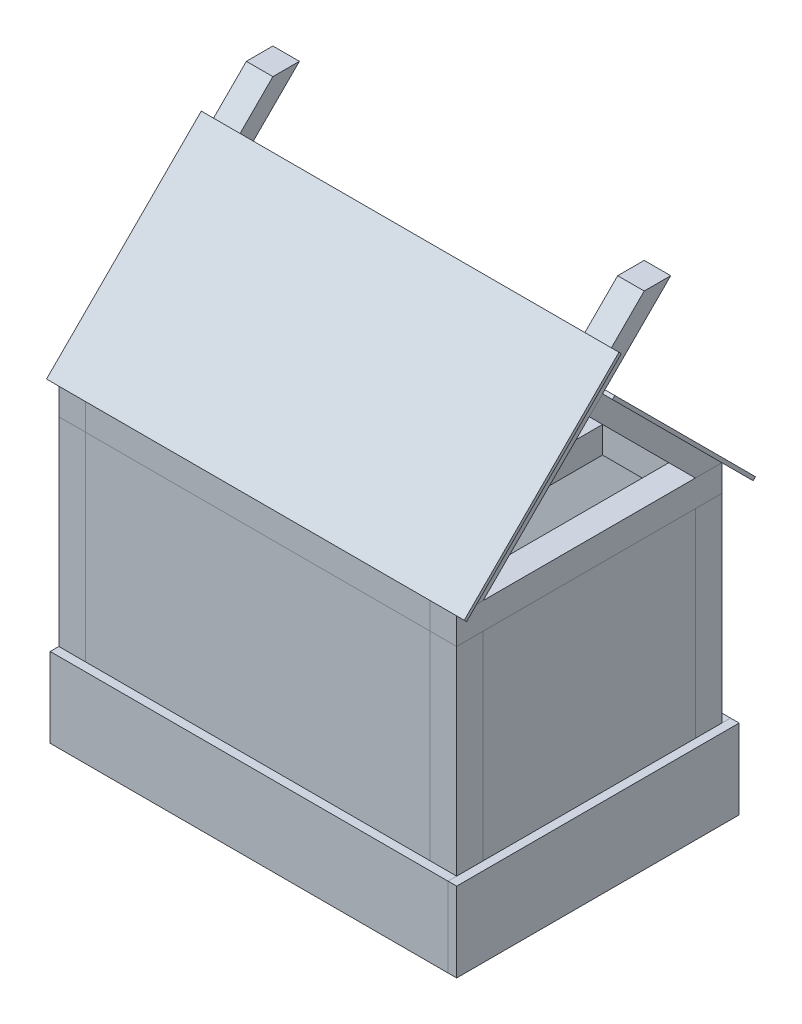
from build123d import *

# Parameters (mm, degrees)
SKETCH1_W              = 60
SKETCH1_H              = 40
BOSS_EXTRUDE1_DEPTH    = 2
SKETCH2_W              = 4
SKETCH2_H              = 4
BOSS_EXTRUDE2_DEPTH    = 40
SKETCH5_W              = 60
SKETCH5_H              = 12
BOSS_EXTRUDE4_DEPTH    = 1.3
SKETCH4_W              = 11
SKETCH4_H              = 7
BOSS_EXTRUDE5_DEPTH    = 1.3
BOSS_EXTRUDE5_2_DEPTH  = 1.3
SKETCH8_W              = 4
SKETCH8_H              = 40
BOSS_EXTRUDE8_DEPTH    = 4
BOSS_EXTRUDE8_2_DEPTH  = 4
SKETCH8_4_W            = 52
SKETCH8_4_H            = 4
BOSS_EXTRUDE9_DEPTH    = 4
BOSS_EXTRUDE9_2_DEPTH  = 4
SKETCH9_W              = 60
SKETCH9_H              = 12
BOSS_EXTRUDE10_DEPTH   = 1.3
SKETCH10_W             = 42.6
SKETCH10_H             = 12
BOSS_EXTRUDE11_DEPTH   = 1.3
SKETCH11_W             = 4
SKETCH11_H             = 32
BOSS_EXTRUDE12_DEPTH   = 4
BOSS_EXTRUDE12_2_DEPTH = 4
SKETCH13_W             = 4
SKETCH13_H             = 4
SWEEP3_START           = -30
SWEEP3_DEPTH           = 4
SKETCH17_W             = 4
SKETCH17_H             = 4
SWEEP5_START           = 26
SWEEP5_DEPTH           = 4
BOSS_EXTRUDE13_DEPTH   = 52
BOSS_EXTRUDE15_DEPTH   = 0.5
SKETCH23_W             = 63
SKETCH23_H             = 33
BOSS_EXTRUDE16_DEPTH   = 0.5
SKETCH24_W             = 52
SKETCH24_H             = 0.5
BOSS_EXTRUDE17_DEPTH   = 1.914214
BOSS_EXTRUDE19_DEPTH   = 0.5
SKETCH29_W             = 52
SKETCH29_H             = 40
BOSS_EXTRUDE21_DEPTH   = 0.5
SKETCH30_W             = 52
SKETCH30_H             = 40
BOSS_EXTRUDE22_DEPTH   = 0.5
SKETCH28_W             = 32
SKETCH28_H             = 40
BOSS_EXTRUDE25_DEPTH   = 0.5


# Read off the part's stored shape, not the designer's step: Sweep3, Sweep5
with BuildPart() as part:
    # Sketch1 → Boss-Extrude1 (new body)
    with BuildSketch(Plane(origin=(0, 0, 0), x_dir=(1, 0, 0), z_dir=(0, 1, 0))):
        Rectangle(SKETCH1_W, SKETCH1_H)
    extrude(amount=BOSS_EXTRUDE1_DEPTH)

    # Sketch2 → Boss-Extrude2 (add)
    with BuildSketch(Plane(origin=(0, 2, 0), x_dir=(1, 0, 0), z_dir=(0, 1, 0))):
        with Locations((-28, 18)):
            Rectangle(SKETCH2_W, SKETCH2_H)
        with Locations((-28, -18)):
            Rectangle(SKETCH2_W, SKETCH2_H)
        with Locations((28, -18)):
            Rectangle(SKETCH2_W, SKETCH2_H)
        with Locations((28, 18)):
            Rectangle(SKETCH2_W, SKETCH2_H)
    extrude(amount=BOSS_EXTRUDE2_DEPTH)


with BuildPart() as body_2:
    # Sketch5 → Boss-Extrude4 (new body)
    with BuildSketch(Plane.XY.offset(20)):
        with Locations((0, 6)):
            Rectangle(SKETCH5_W, SKETCH5_H)
    extrude(amount=BOSS_EXTRUDE4_DEPTH)


with BuildPart() as body_3:
    # Sketch4 → Boss-Extrude5 (new body)
    with BuildSketch(Plane.ZY.offset(30)):
        with Locations((-10.5, 5.5)):
            Rectangle(SKETCH4_W, SKETCH4_H)
    extrude(amount=-BOSS_EXTRUDE5_DEPTH)


with BuildPart() as body_4:
    # Sketch4 → Boss-Extrude5 2 (new body)
    with BuildSketch(Plane.ZY.offset(30)):
        with Locations((10.5, 5.5)):
            Rectangle(SKETCH4_W, SKETCH4_H)
    extrude(amount=-BOSS_EXTRUDE5_2_DEPTH)


with BuildPart() as body_5:
    # Sketch8 → Boss-Extrude8 (new body)
    with BuildSketch(Plane(origin=(0, 42, 0), x_dir=(1, 0, 0), z_dir=(0, 1, 0))):
        with Locations((-28, 0)):
            Rectangle(SKETCH8_W, SKETCH8_H)
    extrude(amount=BOSS_EXTRUDE8_DEPTH)


with BuildPart() as body_6:
    # Sketch8 → Boss-Extrude8 2 (new body)
    with BuildSketch(Plane(origin=(0, 42, 0), x_dir=(1, 0, 0), z_dir=(0, 1, 0))):
        with Locations((28, 0)):
            Rectangle(SKETCH8_W, SKETCH8_H)
    extrude(amount=BOSS_EXTRUDE8_2_DEPTH)


with BuildPart() as body_7:
    # Sketch8<4> → Boss-Extrude9 (new body)
    with BuildSketch(Plane(origin=(0, 42, 0), x_dir=(1, 0, 0), z_dir=(0, 1, 0))):
        with Locations((0, 18)):
            Rectangle(SKETCH8_4_W, SKETCH8_4_H)
    extrude(amount=BOSS_EXTRUDE9_DEPTH)


with BuildPart() as body_8:
    # Sketch8<4> → Boss-Extrude9 2 (new body)
    with BuildSketch(Plane(origin=(0, 42, 0), x_dir=(1, 0, 0), z_dir=(0, 1, 0))):
        with Locations((0, -18)):
            Rectangle(SKETCH8_4_W, SKETCH8_4_H)
    extrude(amount=BOSS_EXTRUDE9_2_DEPTH)


with BuildPart() as body_9:
    # Sketch9 → Boss-Extrude10 (new body)
    with BuildSketch(Plane(origin=(0, 0, -20), x_dir=(-1, 0, 0), z_dir=(0, 0, -1))):
        with Locations((0, 6)):
            Rectangle(SKETCH9_W, SKETCH9_H)
    extrude(amount=BOSS_EXTRUDE10_DEPTH)


with BuildPart() as body_10:
    # Sketch10 → Boss-Extrude11 (new body)
    with BuildSketch(Plane(origin=(30, 0, 0), x_dir=(0, 0, -1), z_dir=(1, 0, 0))):
        with Locations((0, 6)):
            Rectangle(SKETCH10_W, SKETCH10_H)
    extrude(amount=BOSS_EXTRUDE11_DEPTH)


with BuildPart() as body_11:
    # Sketch11 → Boss-Extrude12 (new body)
    with BuildSketch(Plane(origin=(0, 46, 0), x_dir=(1, 0, 0), z_dir=(0, 1, 0))):
        with Locations((-14, 0)):
            Rectangle(SKETCH11_W, SKETCH11_H)
    extrude(amount=-BOSS_EXTRUDE12_DEPTH)


with BuildPart() as body_12:
    # Sketch11 → Boss-Extrude12 2 (new body)
    with BuildSketch(Plane(origin=(0, 46, 0), x_dir=(1, 0, 0), z_dir=(0, 1, 0))):
        with Locations((14, 0)):
            Rectangle(SKETCH11_W, SKETCH11_H)
    extrude(amount=-BOSS_EXTRUDE12_2_DEPTH)


with BuildPart() as body_13:
    # Sweep2: sweep along a path in Sketch14
    with BuildLine(Plane.ZY.offset(28)) as sweep2_path:
        Line((18, 46), (-10.284271247, 74.284271247))
    # Sketch13 → Sweep2 (sweep)
    with BuildSketch(Plane(origin=(0, 46, 0), x_dir=(1, 0, 0), z_dir=(0, 1, 0))):
        with Locations((-28, -18)):
            Rectangle(SKETCH13_W, SKETCH13_H)
    sweep(path=sweep2_path.line)



with BuildPart() as body_14:
    # Sweep3 outline → Sweep3 (new body)
    with BuildSketch(Plane.YZ.offset(SWEEP3_START)):
        Polygon((64, -2), (62, 0), (46, -16), (46, -20), align=None)
    extrude(amount=SWEEP3_DEPTH)


with BuildPart() as body_15:
    # Sweep4: sweep along a path in Sketch18
    with BuildLine(Plane(origin=(28, 0, 0), x_dir=(0, 0, -1), z_dir=(1, 0, 0))) as sweep4_path:
        Line((-18, 46), (10.284271247, 74.284271247))
    # Sketch17 → Sweep4 (sweep)
    with BuildSketch(Plane(origin=(0, 46, 0), x_dir=(1, 0, 0), z_dir=(0, 1, 0))):
        with Locations((28, -18)):
            Rectangle(SKETCH17_W, SKETCH17_H)
    sweep(path=sweep4_path.line)


with BuildPart() as body_16:
    # Sweep5 outline → Sweep5 (new body)
    with BuildSketch(Plane.YZ.offset(SWEEP5_START)):
        Polygon((46, -16), (46, -20), (64, -2), (62, 0), align=None)
    extrude(amount=SWEEP5_DEPTH)


with BuildPart() as body_17:
    # Sketch21 → Boss-Extrude13 (new body)
    with BuildSketch(Plane(origin=(-26, 0, 0), x_dir=(0, 0, -1), z_dir=(1, 0, 0))):
        Polygon((2.999999991, 63.000000009), (0.999999991, 61.000000009), (-0.999999991, 62.999999991), (1.000000009, 64.999999991), align=None)
    extrude(amount=BOSS_EXTRUDE13_DEPTH)


with BuildPart() as body_18:
    # Sketch22 → Boss-Extrude15 (new body)
    with BuildSketch(Plane(origin=(0, 33, -33), x_dir=(1, 0, 0), z_dir=(0, 0.7071067811865477, -0.7071067811865474))):
        Polygon((26, -43.840620434), (26, -45.254833984), (-26, -45.254833984), (-26, -43.840620434), (-31.5, -43.840620434), (-31.5, -13.840620434), (31.5, -13.840620434), (31.5, -43.840620434), align=None)
    extrude(amount=BOSS_EXTRUDE15_DEPTH)


with BuildPart() as body_19:
    # Sketch23 → Boss-Extrude16 (new body)
    with BuildSketch(Plane(origin=(0, 33, 33), x_dir=(1, 0, 0), z_dir=(0, 0.7071067811865477, 0.7071067811865475))):
        with Locations((0, 34.884776311)):
            Rectangle(SKETCH23_W, SKETCH23_H)
    extrude(amount=BOSS_EXTRUDE16_DEPTH)


with BuildPart() as body_13_1:
    add(body_13.part)

    add(body_15.part)  # Boss-Extrude17 merges body 15

    add(body_17.part)  # Boss-Extrude17 merges body 17

    add(body_18.part)  # Boss-Extrude17 merges body 18

    add(body_19.part)  # Boss-Extrude17 merges body 19
    # Sketch24 → Boss-Extrude17 (add)
    with BuildSketch(Plane(origin=(0, 31.999999991, 31.999999991), x_dir=(1, 0, 0), z_dir=(0, 0.7071067811865474, 0.7071067811865477))):
        with Locations((0, 46.919047558)):
            Rectangle(SKETCH24_W, SKETCH24_H)
    extrude(amount=BOSS_EXTRUDE17_DEPTH)


with BuildPart() as body_16_2:
    # Sketch27 → Boss-Extrude19 (new body)
    with BuildSketch(Plane.ZY.offset(30)):
        Polygon((-16, 46), (16, 46), (0, 62), align=None)
    extrude(amount=-BOSS_EXTRUDE19_DEPTH)


with BuildPart() as body_17_2:
    # Sketch29 → Boss-Extrude21 (new body)
    with BuildSketch(Plane(origin=(0, 0, -20), x_dir=(-1, 0, 0), z_dir=(0, 0, -1))):
        with Locations((0, 22)):
            Rectangle(SKETCH29_W, SKETCH29_H)
    extrude(amount=-BOSS_EXTRUDE21_DEPTH)


with BuildPart() as body_18_2:
    # Sketch30 → Boss-Extrude22 (new body)
    with BuildSketch(Plane.XY.offset(20)):
        with Locations((0, 22)):
            Rectangle(SKETCH30_W, SKETCH30_H)
    extrude(amount=-BOSS_EXTRUDE22_DEPTH)


with BuildPart() as body_19_2:
    # Sketch28 → Boss-Extrude25 (new body)
    with BuildSketch(Plane(origin=(30, 0, 0), x_dir=(0, 0, -1), z_dir=(1, 0, 0))):
        with Locations((0, 22)):
            Rectangle(SKETCH28_W, SKETCH28_H)
    extrude(amount=-BOSS_EXTRUDE25_DEPTH)


solid = Compound([part.part, body_2.part, body_3.part, body_4.part, body_5.part, body_6.part, body_7.part, body_8.part, body_9.part, body_10.part, body_11.part, body_12.part, body_14.part, body_16.part, body_13_1.part, body_16_2.part, body_17_2.part, body_18_2.part, body_19_2.part])
